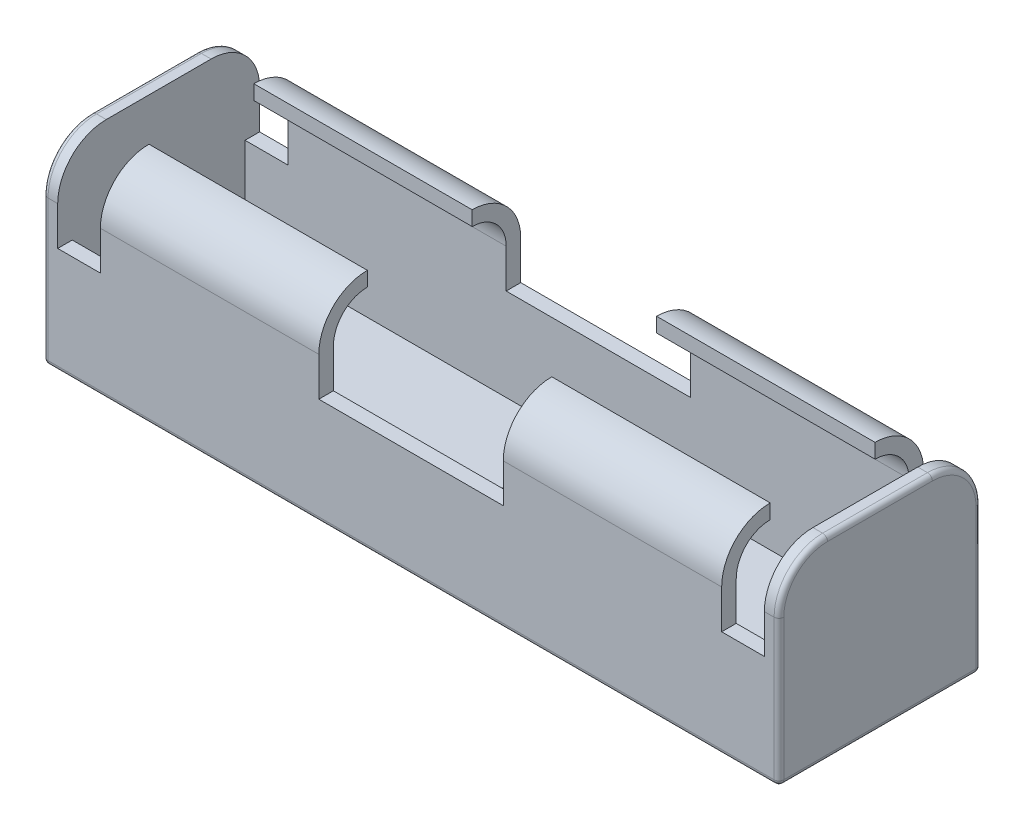
from build123d import *

# Parameters (mm, degrees)
CROQUIS1_W                        = 75.8
CROQUIS1_H                        = 20.8
SALIENTE_EXTRUIR1_DEPTH           = 20
REDONDEO1_R                       = 5
REDONDEO2_R                       = 0.5
VACIADO1_START                    = -36.4
VACIADO1_DEPTH                    = 72.8
CORTAR_EXTRUIR1_DEPTH             = 45.097278828
CORTAR_EXTRUIR1_DEPTH_BACK        = 45.097278828
CORTAR_EXTRUIR2_REACH             = 45.438
CROQUIS3_R                        = 1.75
CORTAR_EXTRUIR2_DIRECTION_2_DEPTH = 44.437541367


# Read off the part's stored shape, not the designer's step: Vaciado1
with BuildPart() as part:
    # Croquis1 → Saliente-Extruir1 (new body)
    with BuildSketch(Plane(origin=(0, 0, 0), x_dir=(1, 0, 0), z_dir=(0, 1, 0))):
        Rectangle(CROQUIS1_W, CROQUIS1_H)
    extrude(amount=SALIENTE_EXTRUIR1_DEPTH)

    # Redondeo1
    redondeo1_edges = [part.edges().sort_by_distance(p)[0] for p in [
        (0, 20, 10.4),
        (0, 20, -10.4),
    ]]
    fillet(redondeo1_edges, radius=REDONDEO1_R)

    # Redondeo2
    redondeo2_edges = [part.edges().sort_by_distance(p)[0] for p in [
        (37.9, 20, 0),
        (-37.9, 20, 0),
        (-37.9, 7.5, 10.4),
        (-37.9, 7.5, -10.4),
        (-37.9, 18.535533906, 8.935533906),
        (-37.9, 18.535533906, -8.935533906),
        (37.9, 7.5, -10.4),
        (37.9, 7.5, 10.4),
        (37.9, 18.535533906, 8.935533906),
        (37.9, 18.535533906, -8.935533906),
        (0, 0, 10.4),
        (-37.9, 0, 0),
        (0, 0, -10.4),
        (37.9, 0, 0),
    ]]
    fillet(redondeo2_edges, radius=REDONDEO2_R)

    # Vaciado1 outline → Vaciado1 (cut)
    with BuildSketch(Plane.YZ.offset(VACIADO1_START)):
        with BuildLine():
            Line((20, -5.4), (20, 5.4))
            Line((20, 5.4), (18.5, 5.4))
            ThreePointArc((18.5, 5.4), (17.474873734, 7.874873734), (15, 8.9))
            Line((15, 8.9), (1.5, 8.9))
            Line((1.5, 8.9), (1.5, -8.9))
            Line((1.5, -8.9), (15, -8.9))
            ThreePointArc((15, -8.9), (17.474873734, -7.874873734), (18.5, -5.4))
            Line((18.5, -5.4), (20, -5.4))
        make_face()
    extrude(amount=VACIADO1_DEPTH, mode=Mode.SUBTRACT)

    # Croquis2 → Cortar-Extruir1 (cut, two sides: drawn at the far end of the back side and taken through both)
    with BuildSketch(Plane.XY.offset(-CORTAR_EXTRUIR1_DEPTH_BACK)):
        Polygon((-9.5, 11), (9.5, 11), (9.5, 20), (32, 20), (32, 11), (36.4, 11), (36.4, 23), (-36.4, 23), (-36.4, 11), (-32, 11), (-32, 20), (-9.5, 20), align=None)
    extrude(amount=CORTAR_EXTRUIR1_DEPTH + CORTAR_EXTRUIR1_DEPTH_BACK, mode=Mode.SUBTRACT)

    # Croquis3 → Cortar-Extruir2 (cut, up to next)
    with BuildSketch(Plane(origin=(0, 1.5, 0), x_dir=(1, 0, 0), z_dir=(0, 1, 0)), mode=Mode.PRIVATE) as cortar_extruir2_sk1:
        with Locations(Location((0, 0, 0), (0, 0, 270))):
            Circle(CROQUIS3_R)
    cortar_extruir2_tool1 = extrude(cortar_extruir2_sk1.sketch, amount=-CORTAR_EXTRUIR2_REACH, mode=Mode.PRIVATE) & part.part
    add(cortar_extruir2_tool1.solids().sort_by_distance((0, 1.5, 0))[0], mode=Mode.SUBTRACT)

    # Croquis3 → Cortar-Extruir2 direction 2 (cut)
    with BuildSketch(Plane(origin=(0, 1.5, 0), x_dir=(1, 0, 0), z_dir=(0, 1, 0))):
        with Locations(Location((0, 0, 0), (0, 0, 270))):
            Circle(CROQUIS3_R)
    extrude(amount=CORTAR_EXTRUIR2_DIRECTION_2_DEPTH, mode=Mode.SUBTRACT)


solid = part.part
